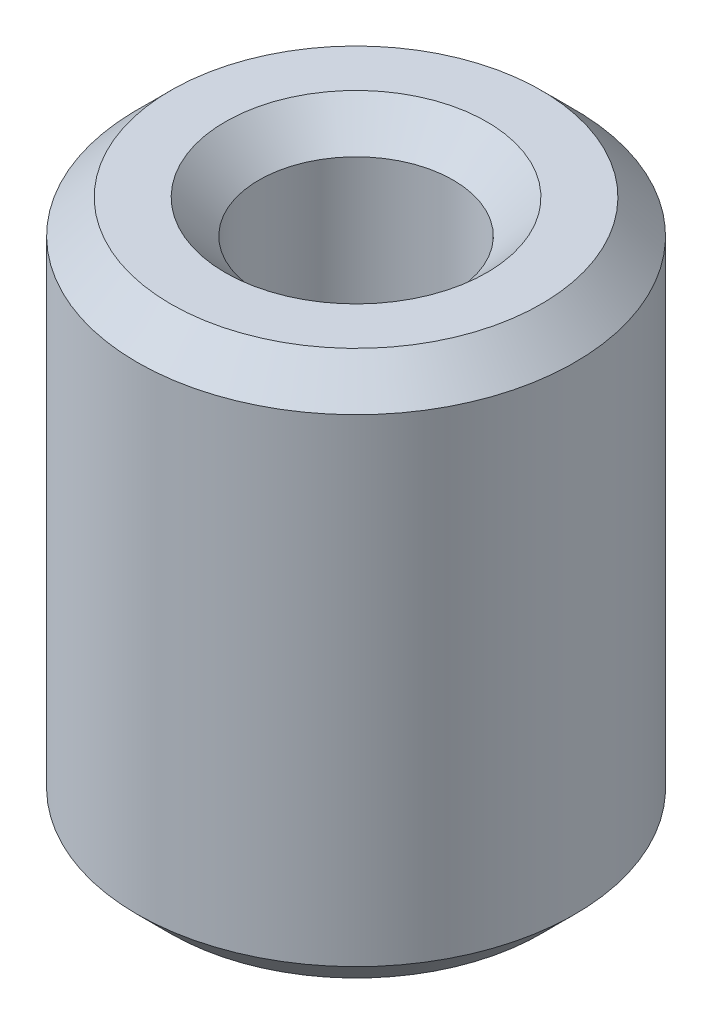
from build123d import *

# Parameters (mm, degrees)
SKETCH1_R           = 17.5
BOSS_EXTRUDE1_DEPTH = 43.609309255
SKETCH2_R           = 7.764907862
CUT_EXTRUDE1_DEPTH  = 51.14251543
CHAMFER1_SIZE       = 2.69144056


with BuildPart() as part:
    # Sketch1 → Boss-Extrude1 (new body)
    with BuildSketch(Plane(origin=(0, 0, 0), x_dir=(1, 0, 0), z_dir=(0, 1, 0))):
        Circle(SKETCH1_R)
    extrude(amount=BOSS_EXTRUDE1_DEPTH)

    # Sketch2 → Cut-Extrude1 (cut, through all)
    with BuildSketch(Plane(origin=(0, 0, 0), x_dir=(1, 0, 0), z_dir=(0, 1, 0))):
        Circle(SKETCH2_R)
    extrude(amount=CUT_EXTRUDE1_DEPTH, mode=Mode.SUBTRACT)

    # Chamfer1
    chamfer1_edges = [part.edges().sort_by_distance(p)[0] for p in [
        (-7.764907862, 43.609309255, 0),
        (-7.764907862, 0, 0),
        (-17.5, 0, 0),
        (-17.5, 43.609309255, 0),
    ]]
    chamfer(chamfer1_edges, length=CHAMFER1_SIZE)


solid = part.part
